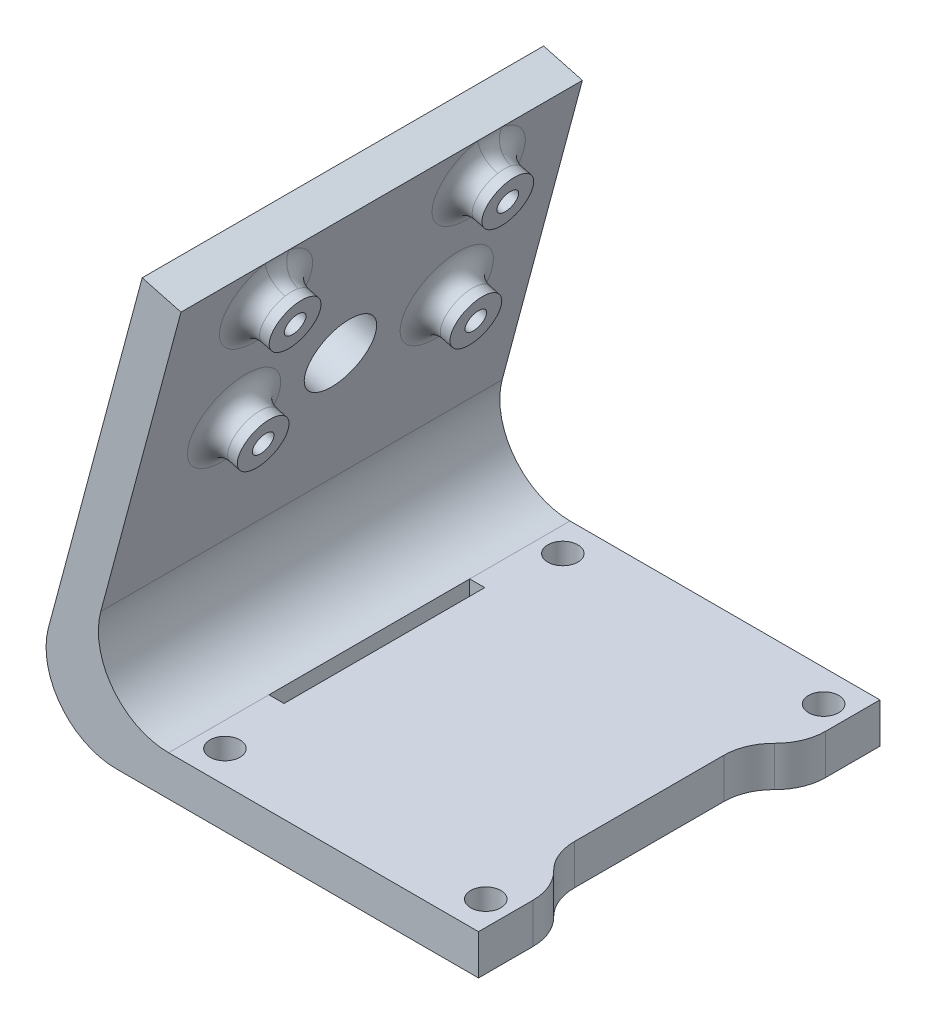
from build123d import *
from build123d.topology import SkipClean

# Parameters (mm, degrees)
ESTRUSIONE_ESTRUSIONE1_DEPTH = 40
RACCORDO1_R                  = 7
SCHIZZO2_W                   = 1.5
SCHIZZO2_H                   = 20
TAGLIO_ESTRUSIONE1_DEPTH     = 40
SCHIZZO3_R                   = 1.05
SCHIZZO3_R_2                 = 3.5
TAGLIO_ESTRUSIONE2_DEPTH     = 40
SCHIZZO4_R                   = 2.5
SCHIZZO4_R_2                 = 1.05
ESTRUSIONE_ESTRUSIONE2_DEPTH = 3
RACCORDO2_R                  = 2
SCHIZZO5_R                   = 1.5
TAGLIO_ESTRUSIONE3_DEPTH     = 17
TAGLIO_ESTRUSIONE4_DEPTH     = 10
RACCORDO3_R                  = 5
RACCORDO4_R                  = 5


with BuildPart() as part:
    # Schizzo1 → Estrusione-Estrusione1 (new body)
    with BuildSketch(Plane.XY):
        Polygon((0, 0), (-40, 0), (-29.647238196, 38.637033052), (-33.510941501, 39.672309232), (-45.212901491, -4), (0, -4), align=None)
    extrude(amount=ESTRUSIONE_ESTRUSIONE1_DEPTH)

    # Raccordo1
    raccordo1_edges = [part.edges().sort_by_distance(p)[0] for p in [
        (-45.212901491, -4, 20),
        (-40, 0, 20),
    ]]
    fillet(raccordo1_edges, radius=RACCORDO1_R)

    # Schizzo2 → Taglio-Estrusione1 (cut)
    with BuildSketch(Plane(origin=(0, 0, 0), x_dir=(1, 0, 0), z_dir=(0, 1, 0))):
        with Locations((-30.12742239, -20)):
            Rectangle(SCHIZZO2_W, SCHIZZO2_H)
    extrude(amount=-TAGLIO_ESTRUSIONE1_DEPTH, mode=Mode.SUBTRACT)

    # Schizzo3 → Taglio-Estrusione2 (cut)
    with BuildSketch(Plane(origin=(-41.184211381, 11.03527618, 0), x_dir=(0, 0, 1), z_dir=(-0.9659258262890673, 0.2588190451025247, 0))):
        with Locations(Location((30.402866557, 25.309568218, 0), (0, 0, 270))):
            Circle(SCHIZZO3_R)
        with Locations(Location((9.20859967, 25.309568218, 0), (0, 0, 270))):
            Circle(SCHIZZO3_R)
        with Locations(Location((30.402866557, 13.009568218, 0), (0, 0, 270))):
            Circle(SCHIZZO3_R)
        with Locations(Location((9.20859967, 13.009568218, 0), (0, 0, 270))):
            Circle(SCHIZZO3_R)
        with Locations(Location((19.902866557, 13.409568216, 0), (0, 0, 270))):
            Circle(SCHIZZO3_R_2)
    extrude(amount=-TAGLIO_ESTRUSIONE2_DEPTH, mode=Mode.SUBTRACT)

    # Schizzo4 → Estrusione-Estrusione2 (add)
    # profile 1 of 4: a face of its own
    with SkipClean():  # the faces are left unmerged after this step: merging them gives an invalid solid
        with BuildSketch(Plane(origin=(-37.320508076, 10, 0), x_dir=(0, 0, -1), z_dir=(0.9659258262890674, -0.2588190451025245, 0))):
            with Locations(Location((-9.20859967, 13.009568218, 0), (0, 0, 270))):
                Circle(SCHIZZO4_R)
            with Locations(Location((-9.20859967, 13.009568218, 0), (0, 0, 90))):
                Circle(SCHIZZO4_R_2, mode=Mode.SUBTRACT)
        # profile 2 of 4: a face of its own
        with BuildSketch(Plane(origin=(-37.320508076, 10, 0), x_dir=(0, 0, -1), z_dir=(0.9659258262890674, -0.2588190451025245, 0))):
            with Locations(Location((-30.402866557, 13.009568218, 0), (0, 0, 270))):
                Circle(SCHIZZO4_R)
            with Locations(Location((-30.402866557, 13.009568218, 0), (0, 0, 270))):
                Circle(SCHIZZO4_R_2, mode=Mode.SUBTRACT)
        # profile 3 of 4: a face of its own
        with BuildSketch(Plane(origin=(-37.320508076, 10, 0), x_dir=(0, 0, -1), z_dir=(0.9659258262890674, -0.2588190451025245, 0))):
            with Locations(Location((-30.402866557, 25.309568218, 0), (0, 0, 270))):
                Circle(SCHIZZO4_R)
            with Locations(Location((-30.402866557, 25.309568218, 0), (0, 0, 270))):
                Circle(SCHIZZO4_R_2, mode=Mode.SUBTRACT)
        # profile 4 of 4: a face of its own
        with BuildSketch(Plane(origin=(-37.320508076, 10, 0), x_dir=(0, 0, -1), z_dir=(0.9659258262890674, -0.2588190451025245, 0))):
            with Locations(Location((-9.20859967, 25.309568218, 0), (0, 0, 270))):
                Circle(SCHIZZO4_R)
            with Locations(Location((-9.20859967, 25.309568218, 0), (0, 0, 90))):
                Circle(SCHIZZO4_R_2, mode=Mode.SUBTRACT)
        extrude(amount=ESTRUSIONE_ESTRUSIONE2_DEPTH)
    add(part.part.scale(1), mode=Mode.REPLACE)  # the faces are merged on a copy

    # Raccordo2
    raccordo2_edges = [part.edges().sort_by_distance(p)[0] for p in [
        (-30.122862185, 36.86198016, 9.20859967),
        (-33.306336439, 24.981092497, 9.20859967),
        (-33.306336439, 24.981092497, 30.402866557),
        (-30.122862185, 36.86198016, 30.402866557),
    ]]
    fillet(raccordo2_edges, radius=RACCORDO2_R)

    # Schizzo5 → Taglio-Estrusione3 (cut)
    with BuildSketch(Plane(origin=(0, 0, 0), x_dir=(1, 0, 0), z_dir=(0, 1, 0))):
        with Locations(Location((-2.444220089, -36.8336475, 0), (0, 0, 180))):
            Circle(SCHIZZO5_R)
        with Locations(Location((-2.444220089, -3.1663525, 0), (0, 0, 180))):
            Circle(SCHIZZO5_R)
        with Locations(Location((-28.433202301, -3.1663525, 0), (0, 0, 180))):
            Circle(SCHIZZO5_R)
        with Locations(Location((-28.433202301, -36.8336475, 0), (0, 0, 180))):
            Circle(SCHIZZO5_R)
    extrude(amount=-TAGLIO_ESTRUSIONE3_DEPTH, mode=Mode.SUBTRACT)

    # Schizzo6 → Taglio-Estrusione4 (cut)
    with BuildSketch(Plane(origin=(0, 0, 0), x_dir=(1, 0, 0), z_dir=(0, 1, 0))):
        Polygon((0, -20), (0, -30), (-3, -30), (-3, -10), (0, -10), align=None)
    extrude(amount=-TAGLIO_ESTRUSIONE4_DEPTH, mode=Mode.SUBTRACT)

    # Raccordo3
    # the kernel refuses this fillet: 5 mm, written as the material it takes off along each edge
    with BuildSketch(Plane(origin=(0, 11.456439237, 10), x_dir=(0, 0, -1), z_dir=(0, -1, 0))) as raccordo3_piece_1:
        with BuildLine():
            CenterArc((4.582575695, -5), RACCORDO3_R, 90, 66.421821522)
            Line((0, -3), (-0.091651514, -2.96))
            ThreePointArc((-0.091651514, -2.96), (-0.1, -1.5), (-0.1, 0))
            Line((-0.1, 0), (0, 0.1))
            Line((0, 0.1), (4.582575695, 0.1))
            Line((4.582575695, 0.1), (4.582575695, 0))
        make_face()
    extrude(amount=26.912878475, mode=Mode.SUBTRACT)
    with BuildSketch(Plane(origin=(0, 11.456439237, 30), x_dir=(0, 0, 1), z_dir=(0, -1, 0))) as raccordo3_piece_2:
        with BuildLine():
            CenterArc((4.582575695, 5), RACCORDO3_R, 203.578178478, 66.421821522)
            Line((0, 3), (-0.091651514, 2.96))
            ThreePointArc((-0.091651514, 2.96), (-0.1, 1.5), (-0.1, 0))
            Line((-0.1, 0), (0, -0.1))
            Line((0, -0.1), (4.582575695, -0.1))
            Line((4.582575695, -0.1), (4.582575695, 0))
        make_face()
    extrude(amount=26.912878475, mode=Mode.SUBTRACT)

    # Raccordo4
    raccordo4_edges = [part.edges().sort_by_distance(p)[0] for p in [
        (-3, -2, 30),
        (-3, -2, 10),
    ]]
    fillet(raccordo4_edges, radius=RACCORDO4_R)


solid = part.part
